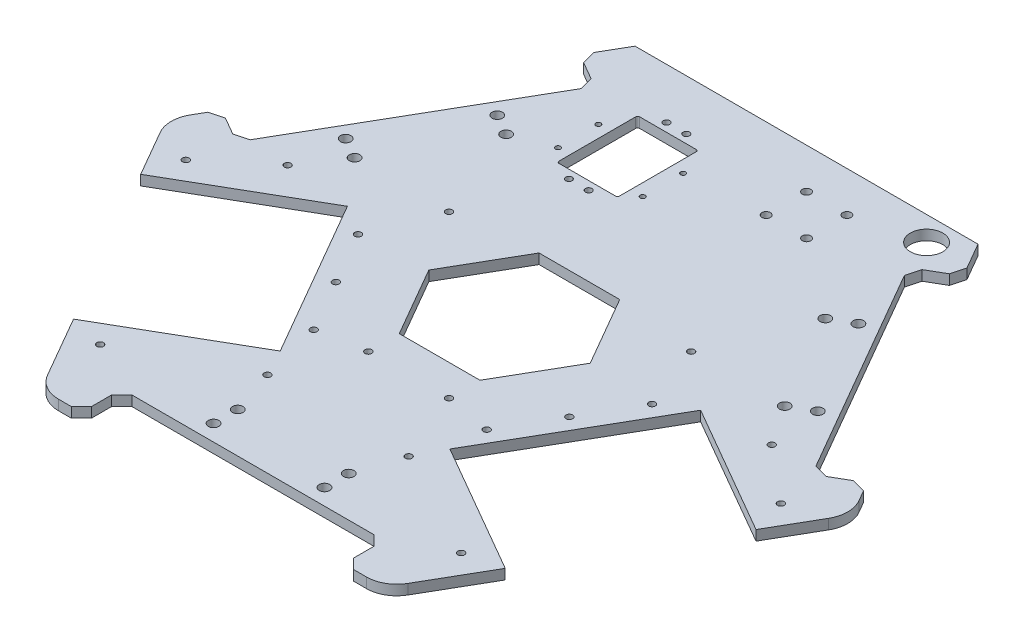
from build123d import *

# Parameters (mm, degrees)
EXTRUDE_1_DEPTH             = 5
CUT_EXTRUDE_31_REACH        = 226.944
SKETCH_46_W                 = 130
SKETCH_46_H                 = 20
SKETCH_8_R                  = 2.6
CUT_EXTRUDE_6_DEPTH         = 225.944437584
PATTERN_CIRCULAR_1_COUNT    = 3
CHAMFER_1_SIZE              = 5
CUT_EXTRUDE_4_DEPTH         = 225.944437584
SKETCH_9_R                  = 1.65
CUT_EXTRUDE_7_DEPTH         = 225.944437584
FILLET_1_R                  = 15
M4X0_7_4_D                  = 3.3
CUT_EXTRUDE_35_REACH        = 225.196
CUT_EXTRUDE_37_REACH        = 225.196
SKETCH_53_R                 = 2.1
PATTERN_LINEAR_1_COUNT      = 2
PATTERN_LINEAR_1_PITCH      = 20
PATTERN_LINEAR_1_COUNT_DIR2 = 2
PATTERN_LINEAR_1_PITCH_DIR2 = 20
CUT_EXTRUDE_38_REACH        = 225.196
SKETCH_54_R                 = 8.05
SKETCH_56_R                 = 1.6
CUT_EXTRUDE_40_DEPTH        = 10
SKETCH_55_W                 = 30
SKETCH_55_H                 = 40
CUT_EXTRUDE_39_DEPTH        = 10
FILLET_2_R                  = 1
M3X0_5_1_D                  = 2.5
M3X0_5_1_DEPTH              = 8.5
M3X0_5_1_TIP                = 0.751075774
M4X0_7_5_AT_2_COUNT         = 2
M4X0_7_5_AT_2_PITCH         = 127.47548784
M4X0_7_5_AT_3_COUNT         = 2
M4X0_7_5_AT_3_PITCH         = 117.686022959
M4X0_7_5_AT_4_COUNT         = 2
M4X0_7_5_AT_4_PITCH         = 38.078865529


with BuildPart() as part:
    # 草圖1 → 填料-伸長1 (new body)
    with BuildSketch(Plane(origin=(0, 0, 0), x_dir=(1, 0, 0), z_dir=(0, 1, 0))):
        Polygon((85, 147.224318643), (-85, 147.224318643), (-170, 0), (-85, -147.224318643), (85, -147.224318643), (170, 0), align=None)
    extrude(amount=EXTRUDE_1_DEPTH)

    # 草圖46 → 除料-伸長31 (cut, up to next)
    with BuildSketch(Plane(origin=(0, 5, 0), x_dir=(1, 0, 0), z_dir=(0, 1, 0)), mode=Mode.PRIVATE) as cut_extrude_31_sk1:
        with Locations((0, -137.224318643)):
            Rectangle(SKETCH_46_W, SKETCH_46_H)
    cut_extrude_31_tool1 = extrude(cut_extrude_31_sk1.sketch, amount=-CUT_EXTRUDE_31_REACH, mode=Mode.PRIVATE) & part.part
    cut_extrude_31 = cut_extrude_31_tool1.solids().sort_by_distance((0, 5, 137.224319))[0]
    add(cut_extrude_31, mode=Mode.SUBTRACT)

    # 草圖8 → 除料-伸長6 (cut, through all)
    with BuildSketch(Plane(origin=(0, 5, 0), x_dir=(1, 0, 0), z_dir=(0, 1, 0))):
        with Locations((-27.5, -119.224318643)):
            Circle(SKETCH_8_R)
        with Locations((27.5, -119.224318643)):
            Circle(SKETCH_8_R)
        with Locations((-27.5, -107.224318643)):
            Circle(SKETCH_8_R)
        with Locations((27.5, -107.224318643)):
            Circle(SKETCH_8_R)
    cut_extrude_6 = extrude(amount=-CUT_EXTRUDE_6_DEPTH, mode=Mode.SUBTRACT)

    # 環狀複製排列1: 除料-伸長31, 除料-伸長6 ×3 about axis
    pattern_circular_1_axis = Axis((0, -0.25, 0), (0, 1, 0))
    add([cut_extrude_31.rotate(pattern_circular_1_axis, i * 360 / PATTERN_CIRCULAR_1_COUNT) for i in range(1, PATTERN_CIRCULAR_1_COUNT)], mode=Mode.SUBTRACT)
    add([cut_extrude_6.rotate(pattern_circular_1_axis, i * 360 / PATTERN_CIRCULAR_1_COUNT) for i in range(1, PATTERN_CIRCULAR_1_COUNT)], mode=Mode.SUBTRACT)

    # 導角1
    chamfer_1_edges = [part.edges().sort_by_distance(p)[0] for p in [
        (65, 2.5, 127.224318643),
        (65, 2.5, 147.224318643),
        (-65, 2.5, 147.224318643),
        (-65, 2.5, 127.224318643),
        (77.679491924, 2.5, -119.903810568),
        (95, 2.5, -129.903810568),
        (160, 2.5, -17.320508076),
        (142.679491924, 2.5, -7.320508076),
        (-160, 2.5, -17.320508076),
        (-142.679491924, 2.5, -7.320508076),
        (-77.679491924, 2.5, -119.903810568),
        (-95, 2.5, -129.903810568),
    ]]
    chamfer(chamfer_1_edges, length=CHAMFER_1_SIZE)

    # 草圖5 → 除料-伸長4 (cut, through all)
    with BuildSketch(Plane(origin=(0, 5, 0), x_dir=(1, 0, 0), z_dir=(0, 1, 0))):
        Polygon((-152.5, -30.310889132), (-107, -109.119200877), (-42.048094716, -71.619200877), (-87.548094716, 7.189110868), align=None)
    cut_extrude_4 = extrude(amount=-CUT_EXTRUDE_4_DEPTH, mode=Mode.SUBTRACT)

    # 草圖9 → 除料-伸長7 (cut, through all)
    with BuildSketch(Plane(origin=(0, 5, 0), x_dir=(1, 0, 0), z_dir=(0, 1, 0))):
        with Locations((-89.491669751, -113.444518424)):
            Circle(SKETCH_9_R)
        with Locations((-147.491669751, -12.985571585)):
            Circle(SKETCH_9_R)
    cut_extrude_7 = extrude(amount=-CUT_EXTRUDE_7_DEPTH, mode=Mode.SUBTRACT)

    # 鏡射1: 除料-伸長4, 除料-伸長7 across plane
    add(cut_extrude_4.mirror(Plane(origin=(0, 0, 0), x_dir=(0, 0, 1), z_dir=(1, 0, 0))), mode=Mode.SUBTRACT)
    add(cut_extrude_7.mirror(Plane(origin=(0, 0, 0), x_dir=(0, 0, 1), z_dir=(1, 0, 0))), mode=Mode.SUBTRACT)

    # 圓角1
    fillet_1_edges = [part.edges().sort_by_distance(p)[0] for p in [
        (170, 2.5, 0),
        (85, 2.5, 147.224318643),
        (-170, 2.5, 0),
        (-85, 2.5, 147.224318643),
    ]]
    fillet(fillet_1_edges, radius=FILLET_1_R)

    # M4x0.7 螺紋孔4 (through all)
    with Locations(Plane(origin=(0, 5, 0), x_dir=(1, 0, 0), z_dir=(0, 1, 0))):
        with Locations((-72.869891486, -2.234282891), (-57.869891486, -28.215045005), (-42.869891486, -54.195807118)):
            m4x0_7_4 = Hole(M4X0_7_4_D / 2)

    # 鏡射2: M4x0.7 螺紋孔4 across plane
    add(m4x0_7_4.mirror(Plane(origin=(0, 0, 0), x_dir=(0, 0, 1), z_dir=(1, 0, 0))), mode=Mode.SUBTRACT)

    # 草圖51 → 除料-伸長35 (cut, up to next)
    with BuildSketch(Plane(origin=(0, 5, 0), x_dir=(1, 0, 0), z_dir=(0, 1, 0)), mode=Mode.PRIVATE) as cut_extrude_35_sk1:
        Polygon((20, 34.641016151), (-20, 34.641016151), (-40, 0), (-20, -34.641016151), (20, -34.641016151), (40, 0), align=None)
    cut_extrude_35_tool1 = extrude(cut_extrude_35_sk1.sketch, amount=-CUT_EXTRUDE_35_REACH, mode=Mode.PRIVATE) & part.part
    add(cut_extrude_35_tool1.solids().sort_by_distance((0, 5, 0))[0], mode=Mode.SUBTRACT)

    # 草圖53 → 除料-伸長37 (cut, up to next)
    with BuildSketch(Plane(origin=(0, 5, 0), x_dir=(1, 0, 0), z_dir=(0, 1, 0)), mode=Mode.PRIVATE) as cut_extrude_37_sk1:
        with Locations((20, 127.224318643)):
            Circle(SKETCH_53_R)
    cut_extrude_37_tool1 = extrude(cut_extrude_37_sk1.sketch, amount=-CUT_EXTRUDE_37_REACH, mode=Mode.PRIVATE) & part.part
    cut_extrude_37 = cut_extrude_37_tool1.solids().sort_by_distance((20, 5, -127.224319))[0]
    add(cut_extrude_37, mode=Mode.SUBTRACT)

    # 直線複製排列1: Cut-Extrude 37 2 × 2
    with Locations(*[(i * PATTERN_LINEAR_1_PITCH, 0, j * PATTERN_LINEAR_1_PITCH_DIR2) for i in range(PATTERN_LINEAR_1_COUNT) for j in range(PATTERN_LINEAR_1_COUNT_DIR2) if (i, j) != (0, 0)]):
        add(cut_extrude_37, mode=Mode.SUBTRACT)

    # 草圖54 → 除料-伸長38 (cut, up to next)
    with BuildSketch(Plane(origin=(0, 5, 0), x_dir=(1, 0, 0), z_dir=(0, 1, 0)), mode=Mode.PRIVATE) as cut_extrude_38_sk1:
        with Locations((71.5, 135.224318643)):
            Circle(SKETCH_54_R)
    cut_extrude_38_tool1 = extrude(cut_extrude_38_sk1.sketch, amount=-CUT_EXTRUDE_38_REACH, mode=Mode.PRIVATE) & part.part
    add(cut_extrude_38_tool1.solids().sort_by_distance((71.5, 5, -135.224319))[0], mode=Mode.SUBTRACT)

    # 草圖56 → 除料-伸長40 (cut)
    with BuildSketch(Plane(origin=(0, 0, 0), x_dir=(-1, 0, 0), z_dir=(0, -1, 0))):
        with Locations((34.6, 122.224318643)):
            Circle(SKETCH_56_R)
        with Locations((44.4, 122.224318643)):
            Circle(SKETCH_56_R)
        with Locations((44.4, 73.824318643)):
            Circle(SKETCH_56_R)
        with Locations((34.6, 73.824318643)):
            Circle(SKETCH_56_R)
    extrude(amount=-CUT_EXTRUDE_40_DEPTH, mode=Mode.SUBTRACT)

    # 草圖55 → 除料-伸長39 (cut)
    with BuildSketch(Plane(origin=(0, 5, 0), x_dir=(1, 0, 0), z_dir=(0, 1, 0))):
        with Locations((-39.5, 98.024318643)):
            Rectangle(SKETCH_55_W, SKETCH_55_H)
    extrude(amount=-CUT_EXTRUDE_39_DEPTH, mode=Mode.SUBTRACT)

    # 圓角2
    fillet_2_edges = [part.edges().sort_by_distance(p)[0] for p in [
        (-54.5, 2.5, -78.024318643),
        (-24.5, 2.5, -78.024318643),
        (-24.5, 2.5, -118.024318643),
        (-54.5, 2.5, -118.024318643),
    ]]
    fillet(fillet_2_edges, radius=FILLET_2_R)

    # M3x0.5 螺紋孔1
    with Locations(Plane(origin=(0, 5, 0), x_dir=(1, 0, 0), z_dir=(0, 1, 0))):
        with Locations((-60.5, 104.524318643), (-60.5, 84.524318643), (-18.5, 84.524318643), (-18.5, 104.524318643)):
            Hole(M3X0_5_1_D / 2, depth=M3X0_5_1_DEPTH)
            with Locations((0, 0, -(M3X0_5_1_DEPTH + M3X0_5_1_TIP / 2))):  # 118° drill point
                Cone(0, M3X0_5_1_D / 2, M3X0_5_1_TIP, mode=Mode.SUBTRACT)

    # 草圖61 → M4x0.7 螺紋孔5 (revolve, cut)
    with BuildSketch(Plane(origin=(-35, 5, 85), x_dir=(0, 0, 1), z_dir=(1, 0, 0))):
        Polygon((0, 0), (0, 12.491420021), (1.65, 11.5), (1.65, 0), align=None)
    m4x0_7_5 = revolve(axis=Axis((-35, 11.35, 85), (0, -1, 0)), mode=Mode.SUBTRACT)

    # M4x0.7 螺紋孔5 at 2: M4x0.7 螺紋孔5 ×2
    with Locations(*[Vector(-0.6667948594698258, 0, -0.7452413135250994) * (i * M4X0_7_5_AT_2_PITCH) for i in range(1, M4X0_7_5_AT_2_COUNT)]):
        add(m4x0_7_5, mode=Mode.SUBTRACT)

    # M4x0.7 螺紋孔5 at 3: M4x0.7 螺紋孔5 ×2
    with Locations(*[Vector(-0.21242964433104375, 0, -0.9771763639228009) * (i * M4X0_7_5_AT_3_PITCH) for i in range(1, M4X0_7_5_AT_3_COUNT)]):
        add(m4x0_7_5, mode=Mode.SUBTRACT)

    # M4x0.7 螺紋孔5 at 4: M4x0.7 螺紋孔5 ×2
    with Locations(*[Vector(0.3939192985791677, 0, -0.9191450300180579) * (i * M4X0_7_5_AT_4_PITCH) for i in range(1, M4X0_7_5_AT_4_COUNT)]):
        add(m4x0_7_5, mode=Mode.SUBTRACT)

    # 鏡射3: M4x0.7 螺紋孔5 across plane
    add(m4x0_7_5.mirror(Plane(origin=(0, 0, 0), x_dir=(0, 0, 1), z_dir=(1, 0, 0))), mode=Mode.SUBTRACT)

    # 鏡射3 copy 1 sketch → 鏡射3 copy 1 (revolve, cut)
    with BuildSketch(Plane(origin=(120, 5, -10), x_dir=(0, 0, 1), z_dir=(-1, 0, 0))):
        Polygon((0, 0), (0, -12.491420021), (1.65, -11.5), (1.65, 0), align=None)
    revolve(axis=Axis((120, 11.35, -10), (0, 1, 0)), mode=Mode.SUBTRACT)

    # 鏡射3 copy 2 sketch → 鏡射3 copy 2 (revolve, cut)
    with BuildSketch(Plane(origin=(60, 5, -30), x_dir=(0, 0, 1), z_dir=(-1, 0, 0))):
        Polygon((0, 0), (0, -12.491420021), (1.65, -11.5), (1.65, 0), align=None)
    revolve(axis=Axis((60, 11.35, -30), (0, 1, 0)), mode=Mode.SUBTRACT)

    # 鏡射3 copy 3 sketch → 鏡射3 copy 3 (revolve, cut)
    with BuildSketch(Plane(origin=(20, 5, 50), x_dir=(0, 0, 1), z_dir=(-1, 0, 0))):
        Polygon((0, 0), (0, -12.491420021), (1.65, -11.5), (1.65, 0), align=None)
    revolve(axis=Axis((20, 11.35, 50), (0, 1, 0)), mode=Mode.SUBTRACT)


solid = part.part
